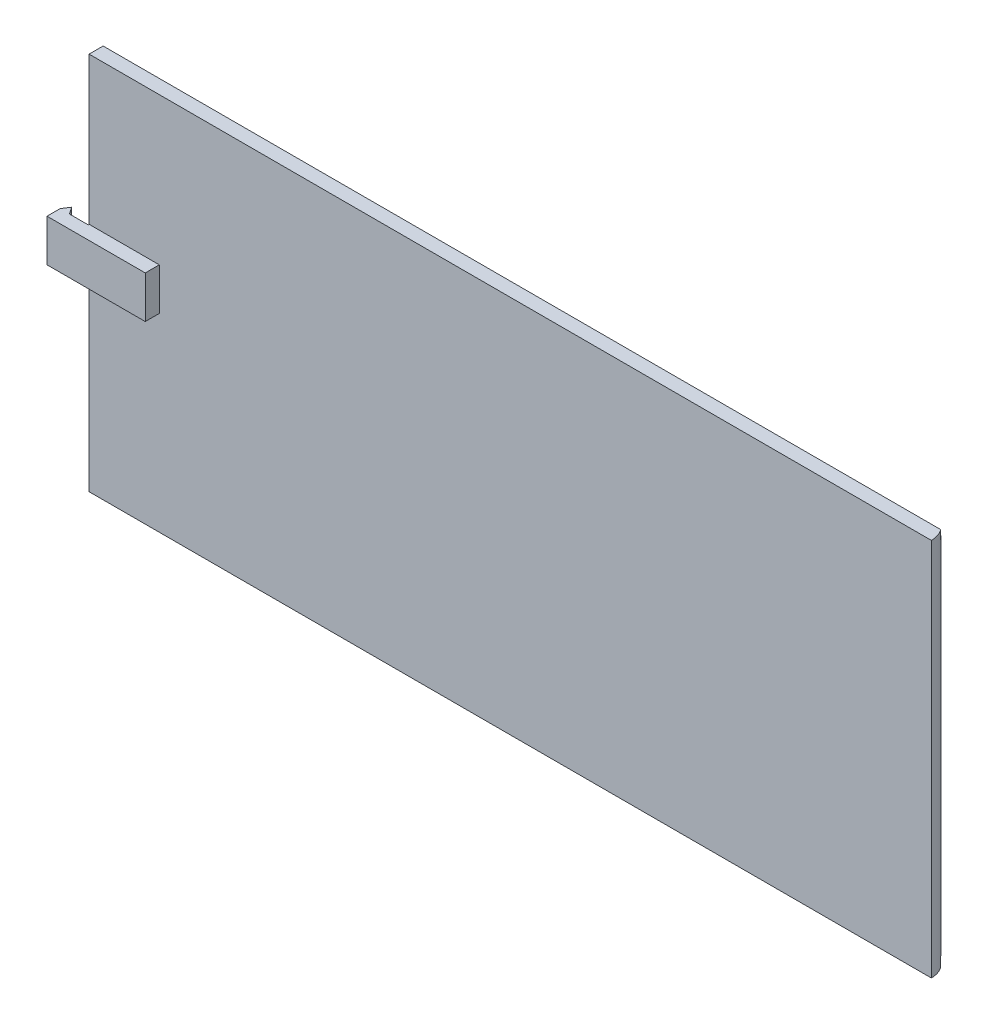
from build123d import *

# Parameters (mm, degrees)
SKETCH1_W           = 180
SKETCH1_H           = 81
BOSS_EXTRUDE1_DEPTH = 5
FILLET1_R           = 5
SKETCH2_W           = 2
SKETCH2_H           = 2
CUT_EXTRUDE1_DEPTH  = 185.567738243
SKETCH3_W           = 15
SKETCH3_H           = 9
BOSS_EXTRUDE2_DEPTH = 3
SKETCH4_W           = 2.8
SKETCH4_H           = 9
BOSS_EXTRUDE3_DEPTH = 6
BOSS_EXTRUDE4_DEPTH = 9


with BuildPart() as part:
    # Sketch1 → Boss-Extrude1 (new body)
    with BuildSketch(Plane.XY):
        Rectangle(SKETCH1_W, SKETCH1_H)
    extrude(amount=BOSS_EXTRUDE1_DEPTH)

    # Fillet1
    fillet1_edges = [part.edges().sort_by_distance(p)[0] for p in [
        (90, 0, 0),
    ]]
    fillet(fillet1_edges, radius=FILLET1_R - 0.0001)  # a hair under: the kernel refuses the full size

    # Sketch2 → Cut-Extrude1 (cut, through all)
    with BuildSketch(Plane.ZY.offset(90)):
        with Locations((1, 39.5)):
            Rectangle(SKETCH2_W, SKETCH2_H)
        with Locations((1, -39.5)):
            Rectangle(SKETCH2_W, SKETCH2_H)
    extrude(amount=-CUT_EXTRUDE1_DEPTH, mode=Mode.SUBTRACT)

    # Sketch3 → Boss-Extrude2 (add)
    with BuildSketch(Plane.XY.offset(5)):
        with Locations((-82.5, 4.5)):
            Rectangle(SKETCH3_W, SKETCH3_H)
    extrude(amount=BOSS_EXTRUDE2_DEPTH)

    # Sketch4 → Boss-Extrude3 (add)
    with BuildSketch(Plane.ZY.offset(90)):
        with Locations((6.6, 4.5)):
            Rectangle(SKETCH4_W, SKETCH4_H)
    extrude(amount=BOSS_EXTRUDE3_DEPTH)

    # Sketch5 → Boss-Extrude4 (add)
    with BuildSketch(Plane(origin=(0, 9, 0), x_dir=(1, 0, 0), z_dir=(0, 1, 0))):
        Polygon((-96, -5.2), (-95.031000632, -3.7), (-94, -5.2), align=None)
    extrude(amount=-BOSS_EXTRUDE4_DEPTH)


solid = part.part
